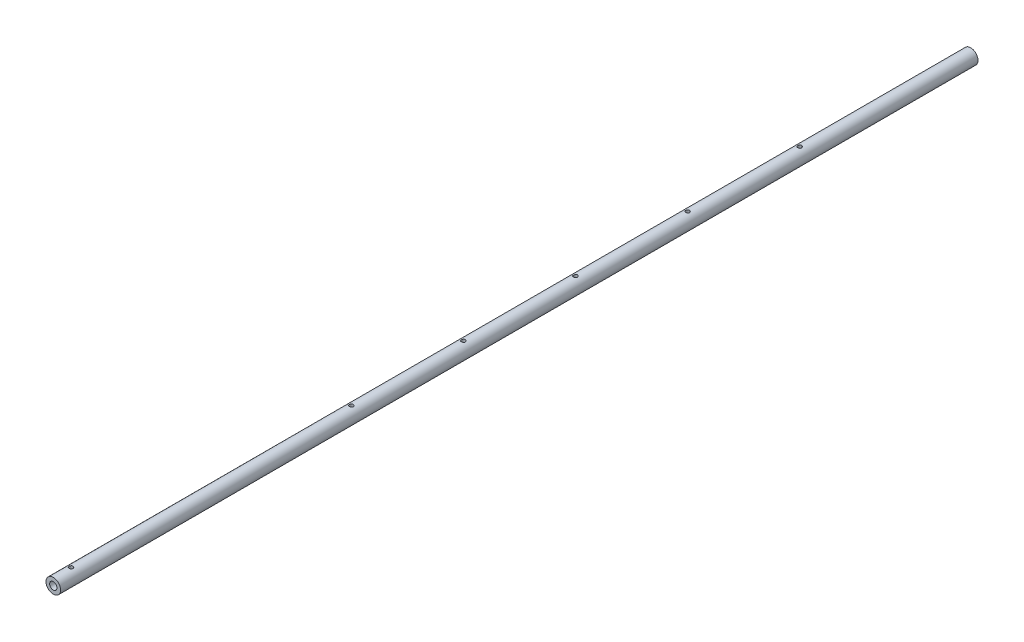
from build123d import *

# Parameters (mm, degrees)
SKETCH1_R        = 7.8613
SKETCH1_R_2      = 3.93065
ROD_DEPTH        = 987.425
HOLES_DEPTH      = 988.487585087
HOLES_DEPTH_BACK = 988.487585087
SKETCH3_R        = 2.1082


with BuildPart() as part:
    # Sketch1 → Rod (new body)
    with BuildSketch(Plane.XY):
        Circle(SKETCH1_R)
        Circle(SKETCH1_R_2, mode=Mode.SUBTRACT)
    extrude(amount=ROD_DEPTH)

    # Sketch3 → Holes (cut, two sides: drawn at the far end of the back side and taken through both)
    with BuildSketch(Plane(origin=(0, 0, 0), x_dir=(1, 0, 0), z_dir=(0, 1, 0)).offset(-HOLES_DEPTH_BACK)):
        with Locations((0, -184.15)):
            Circle(SKETCH3_R)
        with Locations((0, -304.8)):
            Circle(SKETCH3_R)
        with Locations((0, -425.45)):
            Circle(SKETCH3_R)
        with Locations((0, -546.1)):
            Circle(SKETCH3_R)
        with Locations((0, -666.75)):
            Circle(SKETCH3_R)
        with Locations((0, -968.375)):
            Circle(SKETCH3_R)
    extrude(amount=HOLES_DEPTH + HOLES_DEPTH_BACK, mode=Mode.SUBTRACT)


solid = part.part
